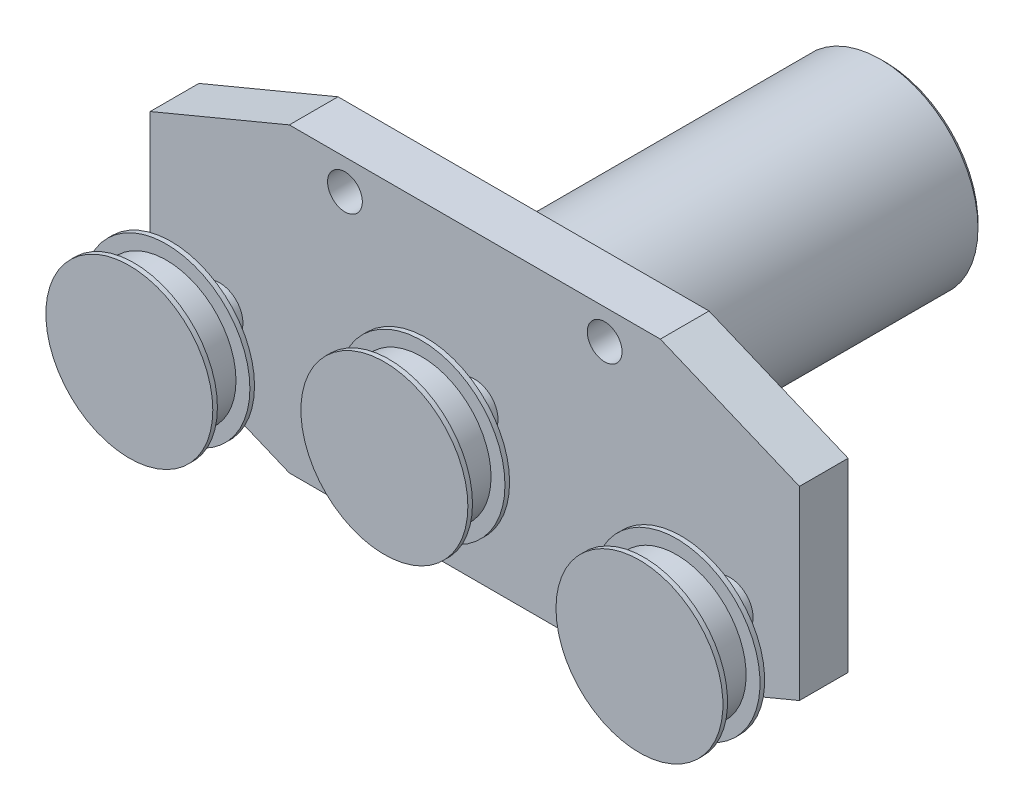
from build123d import *

# Parameters (mm, degrees)
SKETCH1_R           = 2.25
BOSS_EXTRUDE1_DEPTH = 10.5
SKETCH3_R           = 5
BOSS_EXTRUDE2_DEPTH = 10.5
SKETCH4_R           = 3.75
CUT_EXTRUDE1_DEPTH  = 6
SKETCH5_R           = 18
BOSS_EXTRUDE3_DEPTH = 9
SKETCH7_W           = 167.229187532
SKETCH7_H           = 99.836007656
SKETCH7_R           = 15
CUT_EXTRUDE2_DEPTH  = 7
SKETCH8_R           = 21
BOSS_EXTRUDE4_DEPTH = 78
CHAMFER1_SIZE       = 1
SKETCH9_R           = 2
BOSS_EXTRUDE5_DEPTH = 3


with BuildPart() as part:
    # Sketch1 → Boss-Extrude1 (new body)
    with BuildSketch(Plane.XY):
        Polygon((-20, 32.5), (-50, 20), (-50, -20), (-20, -32.5), (20, -32.5), (20, 32.5), align=None)
        with Locations((-8, 26)):
            Circle(SKETCH1_R, mode=Mode.SUBTRACT)
        with Locations((-8, -26)):
            Circle(SKETCH1_R, mode=Mode.SUBTRACT)
    boss_extrude1 = extrude(amount=BOSS_EXTRUDE1_DEPTH)

    # Mirror1: Boss-Extrude1 across plane
    add(boss_extrude1.mirror(Plane(origin=(20, 0, 10.5), x_dir=(0, 0, 1), z_dir=(1, 0, 0))))

    # Sketch3 → Boss-Extrude2 (add)
    with BuildSketch(Plane.XY.offset(10.5)):
        with Locations((20, 0)):
            Circle(SKETCH3_R)
        with Locations((-35, -9.5)):
            Circle(SKETCH3_R)
        with Locations((75, -9.5)):
            Circle(SKETCH3_R)
    extrude(amount=BOSS_EXTRUDE2_DEPTH)

    # Sketch4 → Cut-Extrude1 (cut)
    with BuildSketch(Plane.XY.offset(10.5)):
        with Locations((-8, -26)):
            Circle(SKETCH4_R)
        with Locations((-8, 26)):
            Circle(SKETCH4_R)
        with Locations((48, 26)):
            Circle(SKETCH4_R)
        with Locations((48, -26)):
            Circle(SKETCH4_R)
    extrude(amount=-CUT_EXTRUDE1_DEPTH, mode=Mode.SUBTRACT)

    # Sketch5 → Boss-Extrude3 (add)
    with BuildSketch(Plane.XY.offset(21)):
        with Locations((20, 0)):
            Circle(SKETCH5_R)
        with Locations((-35, -9.5)):
            Circle(SKETCH5_R)
    extrude(amount=BOSS_EXTRUDE3_DEPTH)

    # Sketch7 → Cut-Extrude2 (cut)
    with BuildSketch(Plane.XY.offset(29)):
        with Locations((-35, -9.5)):
            Rectangle(SKETCH7_W, SKETCH7_H)
        with Locations((-35, -9.5)):
            Circle(SKETCH7_R, mode=Mode.SUBTRACT)
        with Locations((20, 0)):
            Circle(SKETCH7_R, mode=Mode.SUBTRACT)
    extrude(amount=-CUT_EXTRUDE2_DEPTH, mode=Mode.SUBTRACT)

    # Mirror2: part across plane


with BuildPart() as part_1:
    add(part.part)
    add(part.part.mirror(Plane(origin=(20, 0, 0), x_dir=(0, 0, 1), z_dir=(1, 0, 0))))

    # Sketch8 → Boss-Extrude4 (add)
    with BuildSketch(Plane(origin=(0, 0, 0), x_dir=(-1, 0, 0), z_dir=(0, 0, -1))):
        with Locations((-20, 0)):
            Circle(SKETCH8_R)
    extrude(amount=BOSS_EXTRUDE4_DEPTH)

    # Chamfer1
    chamfer1_edges = [part_1.edges().sort_by_distance(p)[0] for p in [
        (41, 0, -78),
    ]]
    chamfer(chamfer1_edges, length=CHAMFER1_SIZE)

    # Sketch9 → Boss-Extrude5 (add, symmetric)
    with BuildSketch(Plane(origin=(0, 0, 0), x_dir=(-1, 0, 0), z_dir=(0, 0, -1))):
        with Locations((-75, -9.5)):
            Circle(SKETCH9_R)
        with Locations((35, -9.5)):
            Circle(SKETCH9_R)
    extrude(amount=BOSS_EXTRUDE5_DEPTH, both=True)


solid = part_1.part
